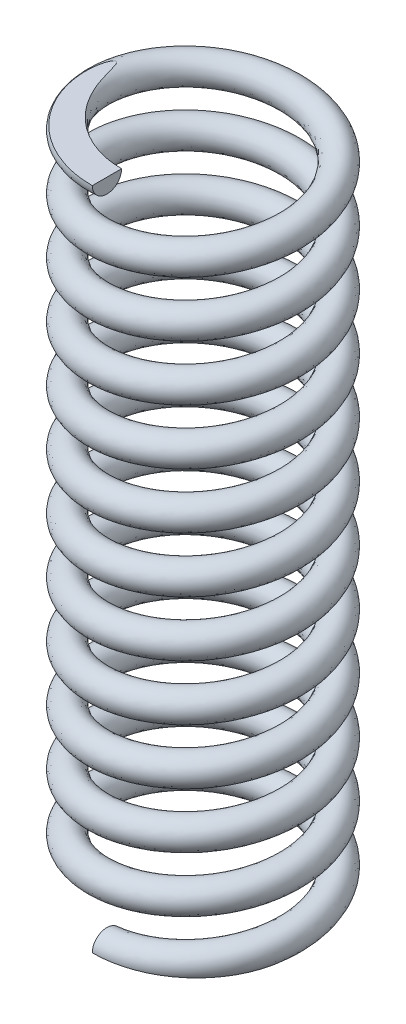
from build123d import *

# Parameters (mm, degrees)
SWEEP1_PITCH       = 13.49375
SWEEP1_HEIGHT      = 161.925
SWEEP1_RADIUS      = 23.413339
SKETCH2_R          = 3.571875
SPLIT1_START       = -3.571875
SPLIT1_OUTLINE_W   = 52
SPLIT1_OUTLINE_H   = 32
SPLIT1_DEPTH       = 3.571875
SPLIT1_START_2     = 161.925
SPLIT1_2_OUTLINE_W = 52
SPLIT1_2_OUTLINE_H = 32
SPLIT1_2_DEPTH     = 3.571875


# Read off the part's stored shape, not the designer's step: Split1
with BuildPart() as part:
    # Sweep1: sweep along a helix
    with BuildLine() as sweep1_path:
        Helix(SWEEP1_PITCH, SWEEP1_HEIGHT, SWEEP1_RADIUS, center=(0, 0, 0), direction=(0, 1, 0))
    # Sketch2 → Sweep1 (sweep)
    with BuildSketch(Plane(origin=(0, 0, 0), x_dir=(0, 0, -1), z_dir=(1, 0, 0))):
        with Locations((-23.415625, 0)):
            Circle(SKETCH2_R)
    sweep(path=sweep1_path.line, is_frenet=True)

    # Split1 outline → Split1 (cut)
    with BuildSketch(Plane(origin=(0, 0, 0), x_dir=(1, 0, 0), z_dir=(0, 1, 0)).offset(SPLIT1_START)):
        with Locations((0, -12)):
            Rectangle(SPLIT1_OUTLINE_W, SPLIT1_OUTLINE_H)
    extrude(amount=SPLIT1_DEPTH, mode=Mode.SUBTRACT)

    # Split1 2 outline → Split1 2 (cut)
    with BuildSketch(Plane(origin=(0, 0, 0), x_dir=(1, 0, 0), z_dir=(0, 1, 0)).offset(SPLIT1_START_2)):
        with Locations((0, -12)):
            Rectangle(SPLIT1_2_OUTLINE_W, SPLIT1_2_OUTLINE_H)
    extrude(amount=SPLIT1_2_DEPTH, mode=Mode.SUBTRACT)


solid = part.part
